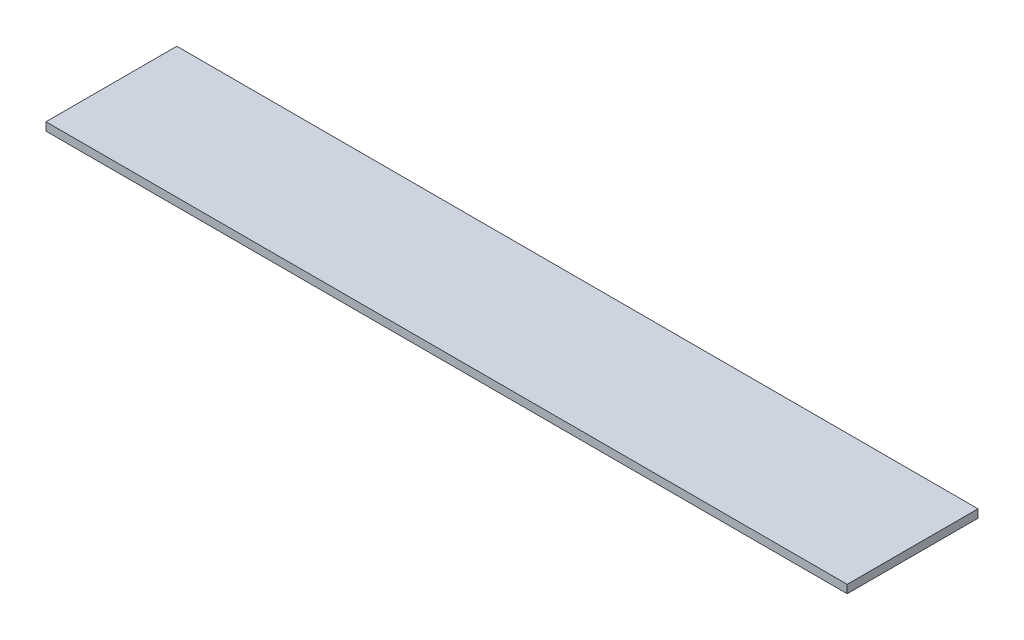
from build123d import *

# Parameters (mm, degrees)
BOSS_EXTRUDE1_DEPTH = 3.175


with BuildPart() as part:
    # Sketch1 → Boss-Extrude1 (new, symmetric)
    with BuildSketch(Plane(origin=(0, 0, 0), x_dir=(1, 0, 0), z_dir=(0, 1, 0))):
        Polygon((-311.15, 50.8), (-311.15, -50.8), (-222.25, -50.8), (-69.85, -50.8), (31.75, -50.8), (234.95, -50.8), (311.15, -50.8), (311.15, 50.8), align=None)
    extrude(amount=BOSS_EXTRUDE1_DEPTH, both=True)


solid = part.part
